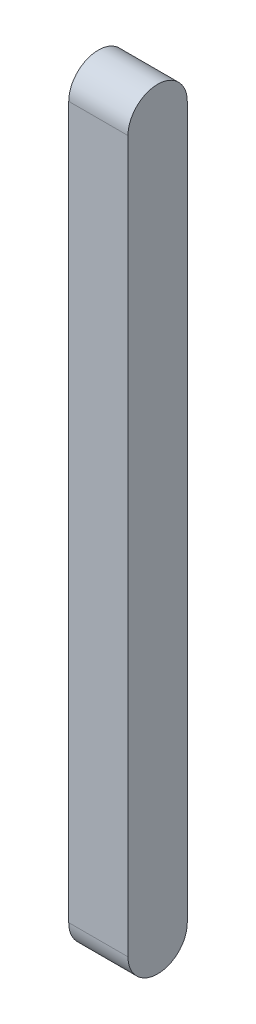
from build123d import *

# Parameters (mm, degrees)
EXTRUDE_1_DEPTH = 10


with BuildPart() as part:
    # 草图1 → 凸台-拉伸1 (new body)
    with BuildSketch(Plane(origin=(0, 0, 0), x_dir=(0, 0, -1), z_dir=(1, 0, 0))):
        with BuildLine():
            ThreePointArc((5, 60), (0, 65), (-5, 60))
            Line((-5, 60), (-5, -60))
            ThreePointArc((-5, -60), (0, -65), (5, -60))
            Line((5, -60), (5, 60))
        make_face()
    extrude(amount=EXTRUDE_1_DEPTH)


solid = part.part
